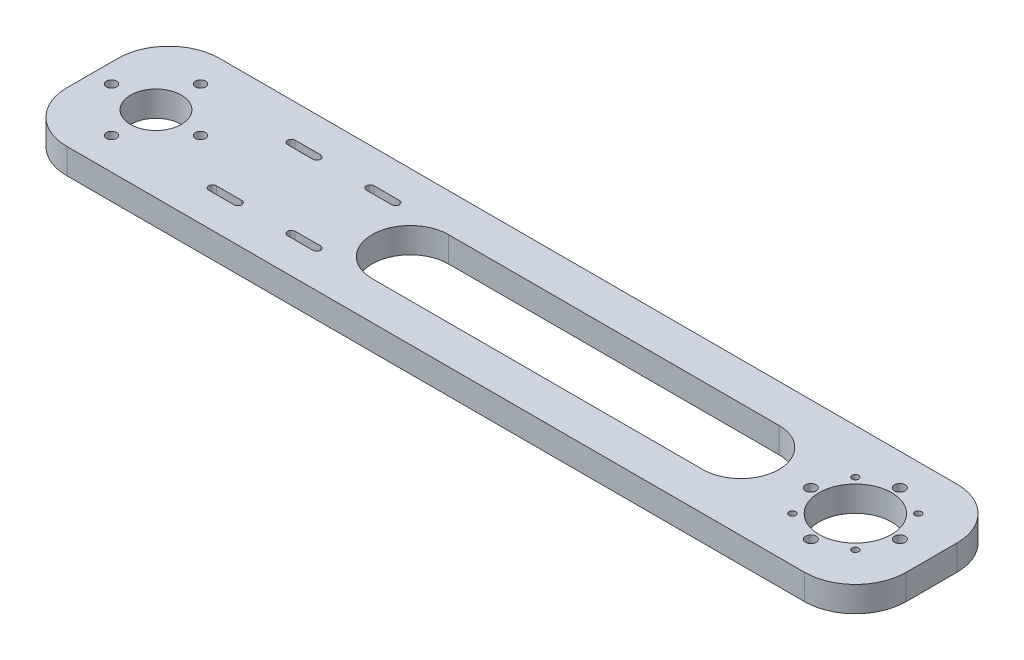
from build123d import *

# Parameters (mm, degrees)
SKETCH_1_W               = 330
SKETCH_1_H               = 60
EXTRUDE_1_DEPTH          = 10
FILLET_1_R               = 20
SKETCH_5_R               = 10
CUT_EXTRUDE_3_DEPTH      = 10
SKETCH_15_R              = 14.25
CUT_EXTRUDE_12_DEPTH     = 169.002976164
SKETCH_18_R              = 1.3
CUT_EXTRUDE_14_DEPTH     = 169.002976164
CUT_EXTRUDE_15_DEPTH     = 169.002976164
SKETCH_20_R              = 2
CUT_EXTRUDE_16_DEPTH     = 10
SKETCH_21_R              = 2.1
CUT_EXTRUDE_17_DEPTH     = 10
CUT_EXTRUDE_18_DEPTH     = 169.002976164
PATTERN_CIRCULAR_1_COUNT = 4


with BuildPart() as part:
    # 草图1 → 凸台-拉伸1 (new body)
    with BuildSketch(Plane(origin=(0, 0, 0), x_dir=(1, 0, 0), z_dir=(0, 1, 0))):
        Rectangle(SKETCH_1_W, SKETCH_1_H)
    extrude(amount=EXTRUDE_1_DEPTH)

    # 圆角1
    fillet_1_edges = [part.edges().sort_by_distance(p)[0] for p in [
        (-165, 5, -30),
        (-165, 5, 30),
        (165, 5, -30),
        (165, 5, 30),
    ]]
    fillet(fillet_1_edges, radius=FILLET_1_R)

    # 草图5 → 切除-拉伸3 (cut)
    with BuildSketch(Plane.XZ):
        with Locations((-140, 0)):
            Circle(SKETCH_5_R)
    extrude(amount=-CUT_EXTRUDE_3_DEPTH, mode=Mode.SUBTRACT)

    # 草图15 → 切除-拉伸12 (cut, through all)
    with BuildSketch(Plane.XZ):
        with Locations((135, 0)):
            Circle(SKETCH_15_R)
    extrude(amount=-CUT_EXTRUDE_12_DEPTH, mode=Mode.SUBTRACT)

    # 草图18 → 切除-拉伸14 (cut, through all)
    with BuildSketch(Plane.XZ):
        with Locations((122.625631329, 12.374368671)):
            Circle(SKETCH_18_R)
        with Locations((147.374368671, 12.374368671)):
            Circle(SKETCH_18_R)
        with Locations((147.374368671, -12.374368671)):
            Circle(SKETCH_18_R)
        with Locations((122.625631329, -12.374368671)):
            Circle(SKETCH_18_R)
    extrude(amount=-CUT_EXTRUDE_14_DEPTH, mode=Mode.SUBTRACT)

    # 草图19 → 切除-拉伸15 (cut, through all)
    with BuildSketch(Plane(origin=(0, 0, 0), x_dir=(-1, 0, 0), z_dir=(0, -1, 0))):
        with BuildLine():
            Line((102.26537952, 17), (92.26537952, 17))
            ThreePointArc((92.26537952, 17), (90.76537952, 15.5), (92.26537952, 14))
            Line((92.26537952, 14), (102.26537952, 14))
            ThreePointArc((102.26537952, 14), (103.76537952, 15.5), (102.26537952, 17))
        make_face()
        with BuildLine():
            Line((71.26537952, -17), (61.26537952, -17))
            ThreePointArc((61.26537952, -17), (59.76537952, -15.5), (61.26537952, -14))
            Line((61.26537952, -14), (71.26537952, -14))
            ThreePointArc((71.26537952, -14), (72.76537952, -15.5), (71.26537952, -17))
        make_face()
        with BuildLine():
            Line((71.26537952, 17), (61.26537952, 17))
            ThreePointArc((61.26537952, 17), (59.76537952, 15.5), (61.26537952, 14))
            Line((61.26537952, 14), (71.26537952, 14))
            ThreePointArc((71.26537952, 14), (72.76537952, 15.5), (71.26537952, 17))
        make_face()
        with BuildLine():
            Line((102.26537952, -17), (92.26537952, -17))
            ThreePointArc((92.26537952, -17), (90.76537952, -15.5), (92.26537952, -14))
            Line((92.26537952, -14), (102.26537952, -14))
            ThreePointArc((102.26537952, -14), (103.76537952, -15.5), (102.26537952, -17))
        make_face()
    extrude(amount=-CUT_EXTRUDE_15_DEPTH, mode=Mode.SUBTRACT)

    # 草图20 → 切除-拉伸16 (cut)
    with BuildSketch(Plane(origin=(0, 10, 0), x_dir=(1, 0, 0), z_dir=(0, 1, 0))):
        with Locations((-140, 17.5)):
            Circle(SKETCH_20_R)
    cut_extrude_16 = extrude(amount=-CUT_EXTRUDE_16_DEPTH, mode=Mode.SUBTRACT)

    # 草图21 → 切除-拉伸17 (cut)
    with BuildSketch(Plane.XZ):
        with Locations((152.5, 0)):
            Circle(SKETCH_21_R)
        with Locations((135, 17.5)):
            Circle(SKETCH_21_R)
        with Locations((135, -17.5)):
            Circle(SKETCH_21_R)
        with Locations((117.5, 0)):
            Circle(SKETCH_21_R)
    extrude(amount=-CUT_EXTRUDE_17_DEPTH, mode=Mode.SUBTRACT)

    # 草图22 → 切除-拉伸18 (cut, through all)
    with BuildSketch(Plane(origin=(0, 10, 0), x_dir=(1, 0, 0), z_dir=(0, 1, 0))):
        with BuildLine():
            Line((-40, 15), (90, 15))
            ThreePointArc((90, 15), (105, 0), (90, -15))
            Line((90, -15), (-40, -15))
            ThreePointArc((-40, -15), (-55, 0), (-40, 15))
        make_face()
    extrude(amount=-CUT_EXTRUDE_18_DEPTH, mode=Mode.SUBTRACT)

    # 阵列(圆周)1: 切除-拉伸16 ×4 about axis
    pattern_circular_1_axis = Axis((-140, 10, 0), (0, -1, 0))
    for i in range(1, PATTERN_CIRCULAR_1_COUNT):
        add(cut_extrude_16.rotate(pattern_circular_1_axis, i * 360 / PATTERN_CIRCULAR_1_COUNT), mode=Mode.SUBTRACT)


solid = part.part
